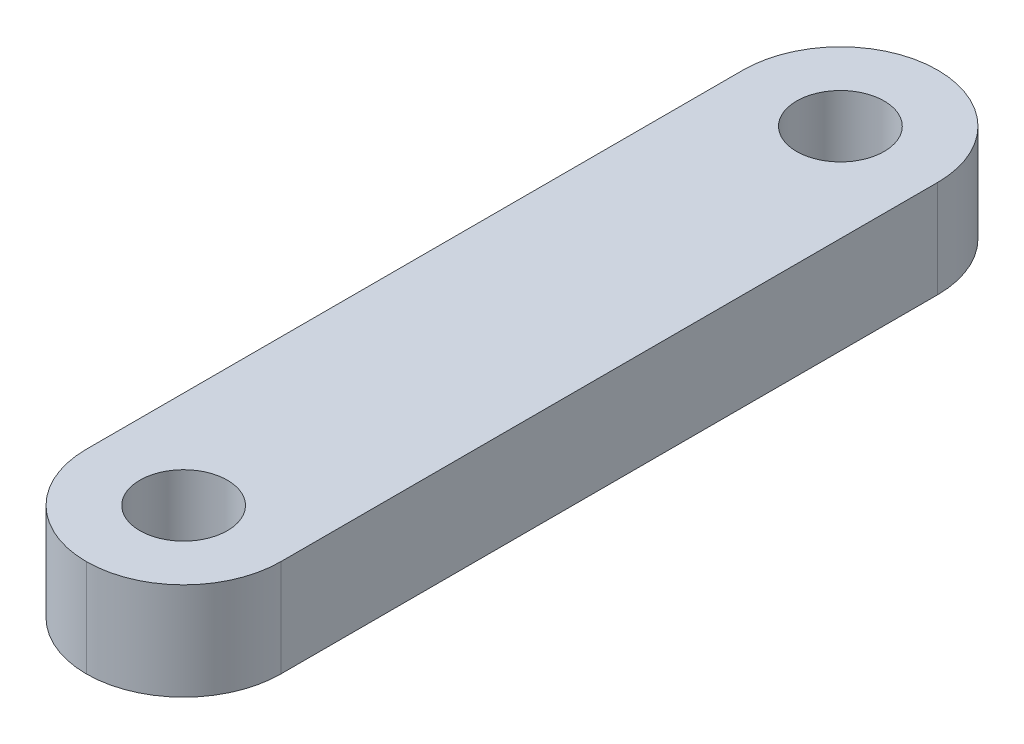
from build123d import *

# Parameters (mm, degrees)
SKETCH1_W           = 8
SKETCH1_H           = 4
BOSS_EXTRUDE1_DEPTH = 35
SKETCH2_R           = 1.8
CUT_EXTRUDE1_DEPTH  = 37.124783736
FILLET1_R           = 4


with BuildPart() as part:
    # Sketch1 → Boss-Extrude1 (new body)
    with BuildSketch(Plane.XY):
        with Locations((4, -2)):
            Rectangle(SKETCH1_W, SKETCH1_H)
    extrude(amount=BOSS_EXTRUDE1_DEPTH)

    # Sketch2 → Cut-Extrude1 (cut, through all)
    with BuildSketch(Plane(origin=(0, 0, 0), x_dir=(1, 0, 0), z_dir=(0, 1, 0))):
        with Locations(Location((4, -4, 0), (0, 0, 270))):
            Circle(SKETCH2_R)
        with Locations(Location((4, -31, 0), (0, 0, 270))):
            Circle(SKETCH2_R)
    extrude(amount=-CUT_EXTRUDE1_DEPTH, mode=Mode.SUBTRACT)

    # Fillet1
    fillet1_edges = [part.edges().sort_by_distance(p)[0] for p in [
        (0, -2, 0),
        (8, -2, 0),
        (0, -2, 35),
        (8, -2, 35),
    ]]
    fillet(fillet1_edges, radius=FILLET1_R - 0.0001)  # a hair under: the kernel refuses the full size


solid = part.part
